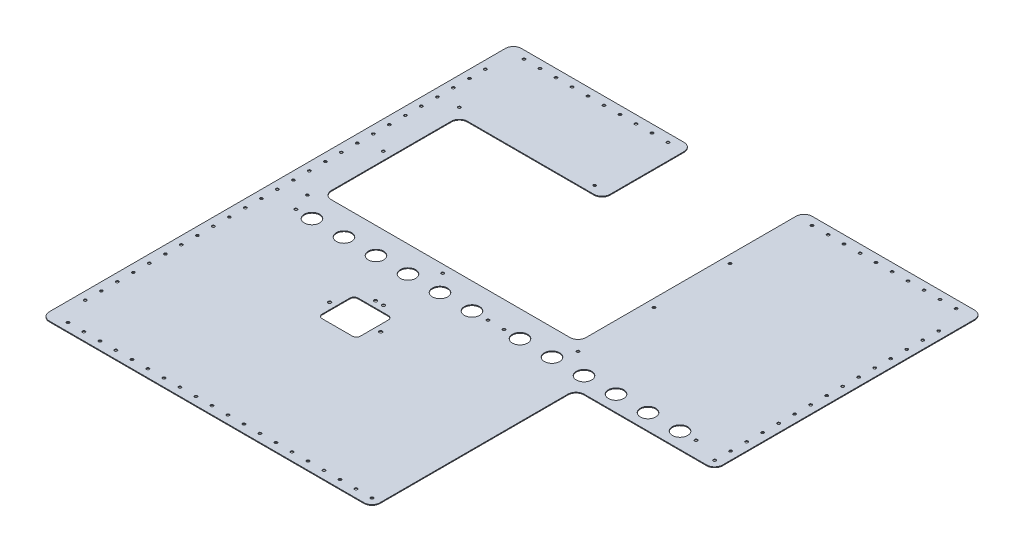
from build123d import *

# Parameters (mm, degrees)
SKETCH1_W                      = 586.53
SKETCH1_H                      = 590
BASE_FLANGE1_DEPTH             = 1
SKETCH6_W                      = 173.27
SKETCH6_H                      = 255
SKETCH6_W_2                    = 318.27
SKETCH6_H_2                    = 170
CUT_EXTRUDE1_DEPTH             = 10
SKETCH9_W                      = 140
SKETCH9_H                      = 112.51
CUT_EXTRUDE2_DEPTH             = 10
FILLET1_R                      = 10
M3_CLEARANCE_HOLE1_AT_2_COUNT  = 2
M3_CLEARANCE_HOLE1_AT_2_PITCH  = 169.135
M3_CLEARANCE_HOLE1_AT_3_COUNT  = 2
M3_CLEARANCE_HOLE1_AT_3_PITCH  = 338.27
M3_CLEARANCE_HOLE1_AT_4_COUNT  = 2
M3_CLEARANCE_HOLE1_AT_4_PITCH  = 351.356788607
M3_CLEARANCE_HOLE1_AT_5_COUNT  = 2
M3_CLEARANCE_HOLE1_AT_5_PITCH  = 387.977567522
M3_CLEARANCE_HOLE1_AT_6_COUNT  = 2
M3_CLEARANCE_HOLE1_AT_6_PITCH  = 254.375014939
M3_CLEARANCE_HOLE1_AT_7_COUNT  = 2
M3_CLEARANCE_HOLE1_AT_7_PITCH  = 190
M3_CLEARANCE_HOLE1_AT_8_COUNT  = 2
M3_CLEARANCE_HOLE1_AT_8_PITCH  = 95
M3_CLEARANCE_HOLE2_AT_2_COUNT  = 2
M3_CLEARANCE_HOLE2_AT_2_PITCH  = 20
M3_CLEARANCE_HOLE2_AT_3_COUNT  = 2
M3_CLEARANCE_HOLE2_AT_3_PITCH  = 40
M3_CLEARANCE_HOLE2_AT_4_COUNT  = 2
M3_CLEARANCE_HOLE2_AT_4_PITCH  = 60
M3_CLEARANCE_HOLE2_AT_5_COUNT  = 2
M3_CLEARANCE_HOLE2_AT_5_PITCH  = 80
M3_CLEARANCE_HOLE2_AT_6_COUNT  = 2
M3_CLEARANCE_HOLE2_AT_6_PITCH  = 100
M3_CLEARANCE_HOLE2_AT_7_COUNT  = 2
M3_CLEARANCE_HOLE2_AT_7_PITCH  = 120
M3_CLEARANCE_HOLE2_AT_8_COUNT  = 2
M3_CLEARANCE_HOLE2_AT_8_PITCH  = 140
M3_CLEARANCE_HOLE2_AT_9_COUNT  = 2
M3_CLEARANCE_HOLE2_AT_9_PITCH  = 160
M3_CLEARANCE_HOLE2_AT_10_COUNT = 2
M3_CLEARANCE_HOLE2_AT_10_PITCH = 180
M3_CLEARANCE_HOLE2_AT_11_COUNT = 2
M3_CLEARANCE_HOLE2_AT_11_PITCH = 200
M3_CLEARANCE_HOLE2_AT_12_COUNT = 2
M3_CLEARANCE_HOLE2_AT_12_PITCH = 220
M3_CLEARANCE_HOLE2_AT_13_COUNT = 2
M3_CLEARANCE_HOLE2_AT_13_PITCH = 240
M3_CLEARANCE_HOLE2_AT_14_COUNT = 2
M3_CLEARANCE_HOLE2_AT_14_PITCH = 260
M3_CLEARANCE_HOLE2_AT_15_COUNT = 2
M3_CLEARANCE_HOLE2_AT_15_PITCH = 280
M3_CLEARANCE_HOLE2_AT_16_COUNT = 2
M3_CLEARANCE_HOLE2_AT_16_PITCH = 300
M3_CLEARANCE_HOLE2_AT_17_COUNT = 2
M3_CLEARANCE_HOLE2_AT_17_PITCH = 320
M3_CLEARANCE_HOLE2_AT_18_COUNT = 2
M3_CLEARANCE_HOLE2_AT_18_PITCH = 340
M3_CLEARANCE_HOLE2_AT_19_COUNT = 2
M3_CLEARANCE_HOLE2_AT_19_PITCH = 360
M3_CLEARANCE_HOLE2_AT_20_COUNT = 2
M3_CLEARANCE_HOLE2_AT_20_PITCH = 380
M3_CLEARANCE_HOLE2_AT_21_COUNT = 2
M3_CLEARANCE_HOLE2_AT_21_PITCH = 37.427631504
M3_CLEARANCE_HOLE2_AT_22_COUNT = 2
M3_CLEARANCE_HOLE2_AT_22_PITCH = 56.575857042
M3_CLEARANCE_HOLE2_AT_23_COUNT = 2
M3_CLEARANCE_HOLE2_AT_23_PITCH = 76.163164325
M3_CLEARANCE_HOLE2_AT_24_COUNT = 2
M3_CLEARANCE_HOLE2_AT_24_PITCH = 95.920944532
M3_CLEARANCE_HOLE2_AT_25_COUNT = 2
M3_CLEARANCE_HOLE2_AT_25_PITCH = 115.76194366
M3_CLEARANCE_HOLE2_AT_26_COUNT = 2
M3_CLEARANCE_HOLE2_AT_26_PITCH = 135.649650202
M3_CLEARANCE_HOLE2_AT_27_COUNT = 2
M3_CLEARANCE_HOLE2_AT_27_PITCH = 155.566151845
M3_CLEARANCE_HOLE2_AT_28_COUNT = 2
M3_CLEARANCE_HOLE2_AT_28_PITCH = 175.501645576
M3_CLEARANCE_HOLE2_AT_29_COUNT = 2
M3_CLEARANCE_HOLE2_AT_29_PITCH = 195.45032003
M3_CLEARANCE_HOLE2_AT_30_COUNT = 2
M3_CLEARANCE_HOLE2_AT_30_PITCH = 215.408513295
M3_CLEARANCE_HOLE2_AT_31_COUNT = 2
M3_CLEARANCE_HOLE2_AT_31_PITCH = 235.37380398
M3_CLEARANCE_HOLE2_AT_32_COUNT = 2
M3_CLEARANCE_HOLE2_AT_32_PITCH = 255.344527257
M3_CLEARANCE_HOLE2_AT_33_COUNT = 2
M3_CLEARANCE_HOLE2_AT_33_PITCH = 275.319500944
M3_CLEARANCE_HOLE2_AT_34_COUNT = 2
M3_CLEARANCE_HOLE2_AT_34_PITCH = 295.297862505
M3_CLEARANCE_HOLE2_AT_35_COUNT = 2
M3_CLEARANCE_HOLE2_AT_35_PITCH = 315.2789679
M3_CLEARANCE_HOLE2_AT_36_COUNT = 2
M3_CLEARANCE_HOLE2_AT_36_PITCH = 335.262326544
M3_CLEARANCE_HOLE2_AT_37_COUNT = 2
M3_CLEARANCE_HOLE2_AT_37_PITCH = 355.24755819
M3_CLEARANCE_HOLE2_AT_38_COUNT = 2
M3_CLEARANCE_HOLE2_AT_38_PITCH = 375.234363565
M3_CLEARANCE_HOLE2_AT_39_COUNT = 2
M3_CLEARANCE_HOLE2_AT_39_PITCH = 395.222503914
M3_CLEARANCE_HOLE2_AT_40_COUNT = 2
M3_CLEARANCE_HOLE2_AT_40_PITCH = 415.211786442
M3_CLEARANCE_HOLE2_AT_41_COUNT = 2
M3_CLEARANCE_HOLE2_AT_41_PITCH = 435.202053764
M3_CLEARANCE_HOLE2_AT_42_COUNT = 2
M3_CLEARANCE_HOLE2_AT_42_PITCH = 455.193176135
M3_CLEARANCE_HOLE2_AT_43_COUNT = 2
M3_CLEARANCE_HOLE2_AT_43_PITCH = 475.18504564
M3_CLEARANCE_HOLE2_AT_44_COUNT = 2
M3_CLEARANCE_HOLE2_AT_44_PITCH = 495.177571786
M3_CLEARANCE_HOLE2_AT_45_COUNT = 2
M3_CLEARANCE_HOLE2_AT_45_PITCH = 515.170678125
M3_CLEARANCE_HOLE2_AT_46_COUNT = 2
M3_CLEARANCE_HOLE2_AT_46_PITCH = 535.164299631
M3_CLEARANCE_HOLE2_AT_47_COUNT = 2
M3_CLEARANCE_HOLE2_AT_47_PITCH = 769.631530604
M3_CLEARANCE_HOLE2_AT_48_COUNT = 2
M3_CLEARANCE_HOLE2_AT_48_PITCH = 755.865525672
M3_CLEARANCE_HOLE2_AT_49_COUNT = 2
M3_CLEARANCE_HOLE2_AT_49_PITCH = 742.383117332
M3_CLEARANCE_HOLE2_AT_50_COUNT = 2
M3_CLEARANCE_HOLE2_AT_50_PITCH = 729.200036273
M3_CLEARANCE_HOLE2_AT_51_COUNT = 2
M3_CLEARANCE_HOLE2_AT_51_PITCH = 716.332808756
M3_CLEARANCE_HOLE2_AT_52_COUNT = 2
M3_CLEARANCE_HOLE2_AT_52_PITCH = 703.798758808
M3_CLEARANCE_HOLE2_AT_53_COUNT = 2
M3_CLEARANCE_HOLE2_AT_53_PITCH = 691.616001044
M3_CLEARANCE_HOLE2_AT_54_COUNT = 2
M3_CLEARANCE_HOLE2_AT_54_PITCH = 679.803422248
M3_CLEARANCE_HOLE2_AT_55_COUNT = 2
M3_CLEARANCE_HOLE2_AT_55_PITCH = 668.380649705
M3_CLEARANCE_HOLE2_AT_56_COUNT = 2
M3_CLEARANCE_HOLE2_AT_56_PITCH = 657.368004165
M3_CLEARANCE_HOLE2_AT_57_COUNT = 2
M3_CLEARANCE_HOLE2_AT_57_PITCH = 646.786435309
M3_CLEARANCE_HOLE2_AT_58_COUNT = 2
M3_CLEARANCE_HOLE2_AT_58_PITCH = 636.657437638
M3_CLEARANCE_HOLE2_AT_59_COUNT = 2
M3_CLEARANCE_HOLE2_AT_59_PITCH = 627.002944889
M3_CLEARANCE_HOLE2_AT_60_COUNT = 2
M3_CLEARANCE_HOLE2_AT_60_PITCH = 617.845201406
M3_CLEARANCE_HOLE2_AT_61_COUNT = 2
M3_CLEARANCE_HOLE2_AT_61_PITCH = 609.20660937
M3_CLEARANCE_HOLE2_AT_62_COUNT = 2
M3_CLEARANCE_HOLE2_AT_62_PITCH = 570
M3_CLEARANCE_HOLE2_AT_63_COUNT = 2
M3_CLEARANCE_HOLE2_AT_63_PITCH = 570.350769264
M3_CLEARANCE_HOLE2_AT_64_COUNT = 2
M3_CLEARANCE_HOLE2_AT_64_PITCH = 571.401785086
M3_CLEARANCE_HOLE2_AT_65_COUNT = 2
M3_CLEARANCE_HOLE2_AT_65_PITCH = 573.149195236
M3_CLEARANCE_HOLE2_AT_66_COUNT = 2
M3_CLEARANCE_HOLE2_AT_66_PITCH = 575.586657246
M3_CLEARANCE_HOLE2_AT_67_COUNT = 2
M3_CLEARANCE_HOLE2_AT_67_PITCH = 578.705451849
M3_CLEARANCE_HOLE2_AT_68_COUNT = 2
M3_CLEARANCE_HOLE2_AT_68_PITCH = 582.494635168
M3_CLEARANCE_HOLE2_AT_69_COUNT = 2
M3_CLEARANCE_HOLE2_AT_69_PITCH = 586.941223633
M3_CLEARANCE_HOLE2_AT_70_COUNT = 2
M3_CLEARANCE_HOLE2_AT_70_PITCH = 592.030404625
M3_CLEARANCE_HOLE2_AT_71_COUNT = 2
M3_CLEARANCE_HOLE2_AT_71_PITCH = 597.745765355
M3_CLEARANCE_HOLE2_AT_72_COUNT = 2
M3_CLEARANCE_HOLE2_AT_72_PITCH = 785.182017178
M3_CLEARANCE_HOLE2_AT_73_COUNT = 2
M3_CLEARANCE_HOLE2_AT_73_PITCH = 771.563607294
M3_CLEARANCE_HOLE2_AT_74_COUNT = 2
M3_CLEARANCE_HOLE2_AT_74_PITCH = 758.228197906
M3_CLEARANCE_HOLE2_AT_75_COUNT = 2
M3_CLEARANCE_HOLE2_AT_75_PITCH = 745.190982299
M3_CLEARANCE_HOLE2_AT_76_COUNT = 2
M3_CLEARANCE_HOLE2_AT_76_PITCH = 732.467883323
M3_CLEARANCE_HOLE2_AT_77_COUNT = 2
M3_CLEARANCE_HOLE2_AT_77_PITCH = 720.075551661
M3_CLEARANCE_HOLE2_AT_78_COUNT = 2
M3_CLEARANCE_HOLE2_AT_78_PITCH = 708.031355309
M3_CLEARANCE_HOLE2_AT_79_COUNT = 2
M3_CLEARANCE_HOLE2_AT_79_PITCH = 696.353358648
M3_CLEARANCE_HOLE2_AT_80_COUNT = 2
M3_CLEARANCE_HOLE2_AT_80_PITCH = 685.060289391
M3_CLEARANCE_HOLE2_AT_81_COUNT = 2
M3_CLEARANCE_HOLE2_AT_81_PITCH = 674.17149161
SKETCH14_R                     = 9.55
CUT_EXTRUDE3_DEPTH             = 10
SKETCH15_R                     = 1.95
CUT_EXTRUDE5_DEPTH             = 416.969181821
SKETCH16_R                     = 1.75
CUT_EXTRUDE6_DEPTH             = 416.969181821


# Sheet-metal steps are written as plain solids
with BuildPart() as part:
    # Sketch1 → Base-Flange1 (new body)
    with BuildSketch(Plane(origin=(0, 0, 0), x_dir=(1, 0, 0), z_dir=(0, 1, 0))):
        Rectangle(SKETCH1_W, SKETCH1_H)
    extrude(amount=-BASE_FLANGE1_DEPTH)

    # Sketch6 → Cut-Extrude1 (cut)
    with BuildSketch(Plane(origin=(0, 0, 0), x_dir=(1, 0, 0), z_dir=(0, 1, 0))):
        with Locations((206.63, -167.5)):
            Rectangle(SKETCH6_W, SKETCH6_H)
        with Locations((-89.13, 97.5)):
            Rectangle(SKETCH6_W_2, SKETCH6_H_2)
    extrude(amount=-CUT_EXTRUDE1_DEPTH, mode=Mode.SUBTRACT)

    # Sketch9 → Cut-Extrude2 (cut)
    with BuildSketch(Plane(origin=(0, 0, 0), x_dir=(1, 0, 0), z_dir=(0, 1, 0))):
        with Locations((0, 238.745)):
            Rectangle(SKETCH9_W, SKETCH9_H)
    extrude(amount=-CUT_EXTRUDE2_DEPTH, mode=Mode.SUBTRACT)

    # Fillet1
    fillet1_edges = [part.edges().sort_by_distance(p)[0] for p in [
        (293.265, -0.5, 40),
        (119.995, -0.5, 295),
        (119.995, -0.5, 40),
        (70.005, -0.5, -12.5),
        (-248.265, -0.5, -12.5),
        (-248.265, -0.5, -182.5),
        (-70, -0.5, -182.5),
        (-70, -0.5, -295),
        (70, -0.5, -295),
        (-293.265, -0.5, 295),
        (-293.265, -0.5, -295),
        (293.265, -0.5, -295),
    ]]
    fillet(fillet1_edges, radius=FILLET1_R)

    # Sketch11 → M3 Clearance Hole1 (revolve, cut)
    with BuildSketch(Plane(origin=(80.005, 0, -192.5), x_dir=(0, 0, 1), z_dir=(1, 0, 0))):
        Polygon((0, 0), (0, 1), (1.7, 1), (1.7, 0.025), (1.725, 0), align=None)
    m3_clearance_hole1 = revolve(axis=Axis((80.005, 6.35, -192.5), (0, -1, 0)), mode=Mode.SUBTRACT)

    # M3 Clearance Hole1 at 2: M3 Clearance Hole1 ×2
    with Locations(*[(-i * M3_CLEARANCE_HOLE1_AT_2_PITCH, 0, 0) for i in range(1, M3_CLEARANCE_HOLE1_AT_2_COUNT)]):
        add(m3_clearance_hole1, mode=Mode.SUBTRACT)

    # M3 Clearance Hole1 at 3: M3 Clearance Hole1 ×2
    with Locations(*[(-i * M3_CLEARANCE_HOLE1_AT_3_PITCH, 0, 0) for i in range(1, M3_CLEARANCE_HOLE1_AT_3_COUNT)]):
        add(m3_clearance_hole1, mode=Mode.SUBTRACT)

    # M3 Clearance Hole1 at 4: M3 Clearance Hole1 ×2
    with Locations(*[Vector(-0.9627535626717866, 0, 0.27038043117574634) * (i * M3_CLEARANCE_HOLE1_AT_4_PITCH) for i in range(1, M3_CLEARANCE_HOLE1_AT_4_COUNT)]):
        add(m3_clearance_hole1, mode=Mode.SUBTRACT)

    # M3 Clearance Hole1 at 5: M3 Clearance Hole1 ×2
    with Locations(*[Vector(-0.8718803052476541, 0, 0.48971903508160425) * (i * M3_CLEARANCE_HOLE1_AT_5_PITCH) for i in range(1, M3_CLEARANCE_HOLE1_AT_5_COUNT)]):
        add(m3_clearance_hole1, mode=Mode.SUBTRACT)

    # M3 Clearance Hole1 at 6: M3 Clearance Hole1 ×2
    with Locations(*[Vector(-0.6649041378566292, 0, 0.7469287030641766) * (i * M3_CLEARANCE_HOLE1_AT_6_PITCH) for i in range(1, M3_CLEARANCE_HOLE1_AT_6_COUNT)]):
        add(m3_clearance_hole1, mode=Mode.SUBTRACT)

    # M3 Clearance Hole1 at 7: M3 Clearance Hole1 ×2
    with Locations(*[(0, 0, i * M3_CLEARANCE_HOLE1_AT_7_PITCH) for i in range(1, M3_CLEARANCE_HOLE1_AT_7_COUNT)]):
        add(m3_clearance_hole1, mode=Mode.SUBTRACT)

    # M3 Clearance Hole1 at 8: M3 Clearance Hole1 ×2
    with Locations(*[(0, 0, i * M3_CLEARANCE_HOLE1_AT_8_PITCH) for i in range(1, M3_CLEARANCE_HOLE1_AT_8_COUNT)]):
        add(m3_clearance_hole1, mode=Mode.SUBTRACT)

    # Sketch13 → M3 Clearance Hole2 (revolve, cut)
    with BuildSketch(Plane(origin=(-270.005, 0, 285), x_dir=(0, 0, 1), z_dir=(1, 0, 0))):
        Polygon((0, 0), (0, 1), (1.7, 1), (1.7, 0.025), (1.725, 0), align=None)
    m3_clearance_hole2 = revolve(axis=Axis((-270.005, 6.35, 285), (0, -1, 0)), mode=Mode.SUBTRACT)

    # M3 Clearance Hole2 at 2: M3 Clearance Hole2 ×2
    with Locations(*[(i * M3_CLEARANCE_HOLE2_AT_2_PITCH, 0, 0) for i in range(1, M3_CLEARANCE_HOLE2_AT_2_COUNT)]):
        add(m3_clearance_hole2, mode=Mode.SUBTRACT)

    # M3 Clearance Hole2 at 3: M3 Clearance Hole2 ×2
    with Locations(*[(i * M3_CLEARANCE_HOLE2_AT_3_PITCH, 0, 0) for i in range(1, M3_CLEARANCE_HOLE2_AT_3_COUNT)]):
        add(m3_clearance_hole2, mode=Mode.SUBTRACT)

    # M3 Clearance Hole2 at 4: M3 Clearance Hole2 ×2
    with Locations(*[(i * M3_CLEARANCE_HOLE2_AT_4_PITCH, 0, 0) for i in range(1, M3_CLEARANCE_HOLE2_AT_4_COUNT)]):
        add(m3_clearance_hole2, mode=Mode.SUBTRACT)

    # M3 Clearance Hole2 at 5: M3 Clearance Hole2 ×2
    with Locations(*[(i * M3_CLEARANCE_HOLE2_AT_5_PITCH, 0, 0) for i in range(1, M3_CLEARANCE_HOLE2_AT_5_COUNT)]):
        add(m3_clearance_hole2, mode=Mode.SUBTRACT)

    # M3 Clearance Hole2 at 6: M3 Clearance Hole2 ×2
    with Locations(*[(i * M3_CLEARANCE_HOLE2_AT_6_PITCH, 0, 0) for i in range(1, M3_CLEARANCE_HOLE2_AT_6_COUNT)]):
        add(m3_clearance_hole2, mode=Mode.SUBTRACT)

    # M3 Clearance Hole2 at 7: M3 Clearance Hole2 ×2
    with Locations(*[(i * M3_CLEARANCE_HOLE2_AT_7_PITCH, 0, 0) for i in range(1, M3_CLEARANCE_HOLE2_AT_7_COUNT)]):
        add(m3_clearance_hole2, mode=Mode.SUBTRACT)

    # M3 Clearance Hole2 at 8: M3 Clearance Hole2 ×2
    with Locations(*[(i * M3_CLEARANCE_HOLE2_AT_8_PITCH, 0, 0) for i in range(1, M3_CLEARANCE_HOLE2_AT_8_COUNT)]):
        add(m3_clearance_hole2, mode=Mode.SUBTRACT)

    # M3 Clearance Hole2 at 9: M3 Clearance Hole2 ×2
    with Locations(*[(i * M3_CLEARANCE_HOLE2_AT_9_PITCH, 0, 0) for i in range(1, M3_CLEARANCE_HOLE2_AT_9_COUNT)]):
        add(m3_clearance_hole2, mode=Mode.SUBTRACT)

    # M3 Clearance Hole2 at 10: M3 Clearance Hole2 ×2
    with Locations(*[(i * M3_CLEARANCE_HOLE2_AT_10_PITCH, 0, 0) for i in range(1, M3_CLEARANCE_HOLE2_AT_10_COUNT)]):
        add(m3_clearance_hole2, mode=Mode.SUBTRACT)

    # M3 Clearance Hole2 at 11: M3 Clearance Hole2 ×2
    with Locations(*[(i * M3_CLEARANCE_HOLE2_AT_11_PITCH, 0, 0) for i in range(1, M3_CLEARANCE_HOLE2_AT_11_COUNT)]):
        add(m3_clearance_hole2, mode=Mode.SUBTRACT)

    # M3 Clearance Hole2 at 12: M3 Clearance Hole2 ×2
    with Locations(*[(i * M3_CLEARANCE_HOLE2_AT_12_PITCH, 0, 0) for i in range(1, M3_CLEARANCE_HOLE2_AT_12_COUNT)]):
        add(m3_clearance_hole2, mode=Mode.SUBTRACT)

    # M3 Clearance Hole2 at 13: M3 Clearance Hole2 ×2
    with Locations(*[(i * M3_CLEARANCE_HOLE2_AT_13_PITCH, 0, 0) for i in range(1, M3_CLEARANCE_HOLE2_AT_13_COUNT)]):
        add(m3_clearance_hole2, mode=Mode.SUBTRACT)

    # M3 Clearance Hole2 at 14: M3 Clearance Hole2 ×2
    with Locations(*[(i * M3_CLEARANCE_HOLE2_AT_14_PITCH, 0, 0) for i in range(1, M3_CLEARANCE_HOLE2_AT_14_COUNT)]):
        add(m3_clearance_hole2, mode=Mode.SUBTRACT)

    # M3 Clearance Hole2 at 15: M3 Clearance Hole2 ×2
    with Locations(*[(i * M3_CLEARANCE_HOLE2_AT_15_PITCH, 0, 0) for i in range(1, M3_CLEARANCE_HOLE2_AT_15_COUNT)]):
        add(m3_clearance_hole2, mode=Mode.SUBTRACT)

    # M3 Clearance Hole2 at 16: M3 Clearance Hole2 ×2
    with Locations(*[(i * M3_CLEARANCE_HOLE2_AT_16_PITCH, 0, 0) for i in range(1, M3_CLEARANCE_HOLE2_AT_16_COUNT)]):
        add(m3_clearance_hole2, mode=Mode.SUBTRACT)

    # M3 Clearance Hole2 at 17: M3 Clearance Hole2 ×2
    with Locations(*[(i * M3_CLEARANCE_HOLE2_AT_17_PITCH, 0, 0) for i in range(1, M3_CLEARANCE_HOLE2_AT_17_COUNT)]):
        add(m3_clearance_hole2, mode=Mode.SUBTRACT)

    # M3 Clearance Hole2 at 18: M3 Clearance Hole2 ×2
    with Locations(*[(i * M3_CLEARANCE_HOLE2_AT_18_PITCH, 0, 0) for i in range(1, M3_CLEARANCE_HOLE2_AT_18_COUNT)]):
        add(m3_clearance_hole2, mode=Mode.SUBTRACT)

    # M3 Clearance Hole2 at 19: M3 Clearance Hole2 ×2
    with Locations(*[(i * M3_CLEARANCE_HOLE2_AT_19_PITCH, 0, 0) for i in range(1, M3_CLEARANCE_HOLE2_AT_19_COUNT)]):
        add(m3_clearance_hole2, mode=Mode.SUBTRACT)

    # M3 Clearance Hole2 at 20: M3 Clearance Hole2 ×2
    with Locations(*[(i * M3_CLEARANCE_HOLE2_AT_20_PITCH, 0, 0) for i in range(1, M3_CLEARANCE_HOLE2_AT_20_COUNT)]):
        add(m3_clearance_hole2, mode=Mode.SUBTRACT)

    # M3 Clearance Hole2 at 21: M3 Clearance Hole2 ×2
    with Locations(*[Vector(-0.3542837061057186, 0, -0.9351379874585337) * (i * M3_CLEARANCE_HOLE2_AT_21_PITCH) for i in range(1, M3_CLEARANCE_HOLE2_AT_21_COUNT)]):
        add(m3_clearance_hole2, mode=Mode.SUBTRACT)

    # M3 Clearance Hole2 at 22: M3 Clearance Hole2 ×2
    with Locations(*[Vector(-0.23437559222889967, 0, -0.9721461216130797) * (i * M3_CLEARANCE_HOLE2_AT_22_PITCH) for i in range(1, M3_CLEARANCE_HOLE2_AT_22_COUNT)]):
        add(m3_clearance_hole2, mode=Mode.SUBTRACT)

    # M3 Clearance Hole2 at 23: M3 Clearance Hole2 ×2
    with Locations(*[Vector(-0.1740999092870426, 0, -0.9847279937049843) * (i * M3_CLEARANCE_HOLE2_AT_23_PITCH) for i in range(1, M3_CLEARANCE_HOLE2_AT_23_COUNT)]):
        add(m3_clearance_hole2, mode=Mode.SUBTRACT)

    # M3 Clearance Hole2 at 24: M3 Clearance Hole2 ×2
    with Locations(*[Vector(-0.138238838917109, 0, -0.9903989213518205) * (i * M3_CLEARANCE_HOLE2_AT_24_PITCH) for i in range(1, M3_CLEARANCE_HOLE2_AT_24_COUNT)]):
        add(m3_clearance_hole2, mode=Mode.SUBTRACT)

    # M3 Clearance Hole2 at 25: M3 Clearance Hole2 ×2
    with Locations(*[Vector(-0.11454541605587176, 0, -0.9934180125509037) * (i * M3_CLEARANCE_HOLE2_AT_25_PITCH) for i in range(1, M3_CLEARANCE_HOLE2_AT_25_COUNT)]):
        add(m3_clearance_hole2, mode=Mode.SUBTRACT)

    # M3 Clearance Hole2 at 26: M3 Clearance Hole2 ×2
    with Locations(*[Vector(-0.09775181860201942, 0, -0.9952108228712135) * (i * M3_CLEARANCE_HOLE2_AT_26_PITCH) for i in range(1, M3_CLEARANCE_HOLE2_AT_26_COUNT)]):
        add(m3_clearance_hole2, mode=Mode.SUBTRACT)

    # M3 Clearance Hole2 at 27: M3 Clearance Hole2 ×2
    with Locations(*[Vector(-0.08523705087964259, 0, -0.9963607003276179) * (i * M3_CLEARANCE_HOLE2_AT_27_PITCH) for i in range(1, M3_CLEARANCE_HOLE2_AT_27_COUNT)]):
        add(m3_clearance_hole2, mode=Mode.SUBTRACT)

    # M3 Clearance Hole2 at 28: M3 Clearance Hole2 ×2
    with Locations(*[Vector(-0.07555484711528443, 0, -0.9971416474490402) * (i * M3_CLEARANCE_HOLE2_AT_28_PITCH) for i in range(1, M3_CLEARANCE_HOLE2_AT_28_COUNT)]):
        add(m3_clearance_hole2, mode=Mode.SUBTRACT)

    # M3 Clearance Hole2 at 29: M3 Clearance Hole2 ×2
    with Locations(*[Vector(-0.06784332713262199, 0, -0.997695987244399) * (i * M3_CLEARANCE_HOLE2_AT_29_PITCH) for i in range(1, M3_CLEARANCE_HOLE2_AT_29_COUNT)]):
        add(m3_clearance_hole2, mode=Mode.SUBTRACT)

    # M3 Clearance Hole2 at 30: M3 Clearance Hole2 ×2
    with Locations(*[Vector(-0.06155745563238609, 0, -0.9981035415507085) * (i * M3_CLEARANCE_HOLE2_AT_30_PITCH) for i in range(1, M3_CLEARANCE_HOLE2_AT_30_COUNT)]):
        add(m3_clearance_hole2, mode=Mode.SUBTRACT)

    # M3 Clearance Hole2 at 31: M3 Clearance Hole2 ×2
    with Locations(*[Vector(-0.056335920887480066, 0, -0.9984118709319113) * (i * M3_CLEARANCE_HOLE2_AT_31_PITCH) for i in range(1, M3_CLEARANCE_HOLE2_AT_31_COUNT)]):
        add(m3_clearance_hole2, mode=Mode.SUBTRACT)

    # M3 Clearance Hole2 at 32: M3 Clearance Hole2 ×2
    with Locations(*[Vector(-0.051929838256000956, 0, -0.9986507356922668) * (i * M3_CLEARANCE_HOLE2_AT_32_PITCH) for i in range(1, M3_CLEARANCE_HOLE2_AT_32_COUNT)]):
        add(m3_clearance_hole2, mode=Mode.SUBTRACT)

    # M3 Clearance Hole2 at 33: M3 Clearance Hole2 ×2
    with Locations(*[Vector(-0.04816222590314291, 0, -0.9988395266488279) * (i * M3_CLEARANCE_HOLE2_AT_33_PITCH) for i in range(1, M3_CLEARANCE_HOLE2_AT_33_COUNT)]):
        add(m3_clearance_hole2, mode=Mode.SUBTRACT)

    # M3 Clearance Hole2 at 34: M3 Clearance Hole2 ×2
    with Locations(*[Vector(-0.04490381300940858, 0, -0.9989913150659601) * (i * M3_CLEARANCE_HOLE2_AT_34_PITCH) for i in range(1, M3_CLEARANCE_HOLE2_AT_34_COUNT)]):
        add(m3_clearance_hole2, mode=Mode.SUBTRACT)

    # M3 Clearance Hole2 at 35: M3 Clearance Hole2 ×2
    with Locations(*[Vector(-0.04205799101769677, 0, -0.9991151712348059) * (i * M3_CLEARANCE_HOLE2_AT_35_PITCH) for i in range(1, M3_CLEARANCE_HOLE2_AT_35_COUNT)]):
        add(m3_clearance_hole2, mode=Mode.SUBTRACT)

    # M3 Clearance Hole2 at 36: M3 Clearance Hole2 ×2
    with Locations(*[Vector(-0.039551118482866195, 0, -0.9992175483981225) * (i * M3_CLEARANCE_HOLE2_AT_36_PITCH) for i in range(1, M3_CLEARANCE_HOLE2_AT_36_COUNT)]):
        add(m3_clearance_hole2, mode=Mode.SUBTRACT)

    # M3 Clearance Hole2 at 37: M3 Clearance Hole2 ×2
    with Locations(*[Vector(-0.03732608344321662, 0, -0.9993031389397264) * (i * M3_CLEARANCE_HOLE2_AT_37_PITCH) for i in range(1, M3_CLEARANCE_HOLE2_AT_37_COUNT)]):
        add(m3_clearance_hole2, mode=Mode.SUBTRACT)

    # M3 Clearance Hole2 at 38: M3 Clearance Hole2 ×2
    with Locations(*[Vector(-0.03533791488077733, 0, -0.9993754208363737) * (i * M3_CLEARANCE_HOLE2_AT_38_PITCH) for i in range(1, M3_CLEARANCE_HOLE2_AT_38_COUNT)]):
        add(m3_clearance_hole2, mode=Mode.SUBTRACT)

    # M3 Clearance Hole2 at 39: M3 Clearance Hole2 ×2
    with Locations(*[Vector(-0.03355072109681487, 0, -0.9994370160814956) * (i * M3_CLEARANCE_HOLE2_AT_39_PITCH) for i in range(1, M3_CLEARANCE_HOLE2_AT_39_COUNT)]):
        add(m3_clearance_hole2, mode=Mode.SUBTRACT)

    # M3 Clearance Hole2 at 40: M3 Clearance Hole2 ×2
    with Locations(*[Vector(-0.03193550961941994, 0, -0.9994899315277508) * (i * M3_CLEARANCE_HOLE2_AT_40_PITCH) for i in range(1, M3_CLEARANCE_HOLE2_AT_40_COUNT)]):
        add(m3_clearance_hole2, mode=Mode.SUBTRACT)

    # M3 Clearance Hole2 at 41: M3 Clearance Hole2 ×2
    with Locations(*[Vector(-0.03046860621481826, 0, -0.9995357242416733) * (i * M3_CLEARANCE_HOLE2_AT_41_PITCH) for i in range(1, M3_CLEARANCE_HOLE2_AT_41_COUNT)]):
        add(m3_clearance_hole2, mode=Mode.SUBTRACT)

    # M3 Clearance Hole2 at 42: M3 Clearance Hole2 ×2
    with Locations(*[Vector(-0.02913048941679347, 0, -0.9995756172428067) * (i * M3_CLEARANCE_HOLE2_AT_42_PITCH) for i in range(1, M3_CLEARANCE_HOLE2_AT_42_COUNT)]):
        add(m3_clearance_hole2, mode=Mode.SUBTRACT)

    # M3 Clearance Hole2 at 43: M3 Clearance Hole2 ×2
    with Locations(*[Vector(-0.027904918561018805, 0, -0.9996105819368375) * (i * M3_CLEARANCE_HOLE2_AT_43_PITCH) for i in range(1, M3_CLEARANCE_HOLE2_AT_43_COUNT)]):
        add(m3_clearance_hole2, mode=Mode.SUBTRACT)

    # M3 Clearance Hole2 at 44: M3 Clearance Hole2 ×2
    with Locations(*[Vector(-0.026778272594560903, 0, -0.9996413977606426) * (i * M3_CLEARANCE_HOLE2_AT_44_PITCH) for i in range(1, M3_CLEARANCE_HOLE2_AT_44_COUNT)]):
        add(m3_clearance_hole2, mode=Mode.SUBTRACT)

    # M3 Clearance Hole2 at 45: M3 Clearance Hole2 ×2
    with Locations(*[Vector(-0.02573904254072972, 0, -0.9996686959633609) * (i * M3_CLEARANCE_HOLE2_AT_45_PITCH) for i in range(1, M3_CLEARANCE_HOLE2_AT_45_COUNT)]):
        add(m3_clearance_hole2, mode=Mode.SUBTRACT)

    # M3 Clearance Hole2 at 46: M3 Clearance Hole2 ×2
    with Locations(*[Vector(-0.024777437525511124, 0, -0.9996929921679303) * (i * M3_CLEARANCE_HOLE2_AT_46_PITCH) for i in range(1, M3_CLEARANCE_HOLE2_AT_46_COUNT)]):
        add(m3_clearance_hole2, mode=Mode.SUBTRACT)

    # M3 Clearance Hole2 at 47: M3 Clearance Hole2 ×2
    with Locations(*[Vector(0.7188764727008147, 0, -0.6951378402858205) * (i * M3_CLEARANCE_HOLE2_AT_47_PITCH) for i in range(1, M3_CLEARANCE_HOLE2_AT_47_COUNT)]):
        add(m3_clearance_hole2, mode=Mode.SUBTRACT)

    # M3 Clearance Hole2 at 48: M3 Clearance Hole2 ×2
    with Locations(*[Vector(0.7319688240945119, 0, -0.6813381249817874) * (i * M3_CLEARANCE_HOLE2_AT_48_PITCH) for i in range(1, M3_CLEARANCE_HOLE2_AT_48_COUNT)]):
        add(m3_clearance_hole2, mode=Mode.SUBTRACT)

    # M3 Clearance Hole2 at 49: M3 Clearance Hole2 ×2
    with Locations(*[Vector(0.7452620986158033, 0, -0.6667716283456944) * (i * M3_CLEARANCE_HOLE2_AT_49_PITCH) for i in range(1, M3_CLEARANCE_HOLE2_AT_49_COUNT)]):
        add(m3_clearance_hole2, mode=Mode.SUBTRACT)

    # M3 Clearance Hole2 at 50: M3 Clearance Hole2 ×2
    with Locations(*[Vector(0.7587355629164406, 0, -0.6513987607954685) * (i * M3_CLEARANCE_HOLE2_AT_50_PITCH) for i in range(1, M3_CLEARANCE_HOLE2_AT_50_COUNT)]):
        add(m3_clearance_hole2, mode=Mode.SUBTRACT)

    # M3 Clearance Hole2 at 51: M3 Clearance Hole2 ×2
    with Locations(*[Vector(0.7723644557911035, 0, -0.6351796182423618) * (i * M3_CLEARANCE_HOLE2_AT_51_PITCH) for i in range(1, M3_CLEARANCE_HOLE2_AT_51_COUNT)]):
        add(m3_clearance_hole2, mode=Mode.SUBTRACT)

    # M3 Clearance Hole2 at 52: M3 Clearance Hole2 ×2
    with Locations(*[Vector(0.7861196017692288, 0, -0.6180744062927934) * (i * M3_CLEARANCE_HOLE2_AT_52_PITCH) for i in range(1, M3_CLEARANCE_HOLE2_AT_52_COUNT)]):
        add(m3_clearance_hole2, mode=Mode.SUBTRACT)

    # M3 Clearance Hole2 at 53: M3 Clearance Hole2 ×2
    with Locations(*[Vector(0.7999670325222225, 0, -0.600043954121354) * (i * M3_CLEARANCE_HOLE2_AT_53_PITCH) for i in range(1, M3_CLEARANCE_HOLE2_AT_53_COUNT)]):
        add(m3_clearance_hole2, mode=Mode.SUBTRACT)

    # M3 Clearance Hole2 at 54: M3 Clearance Hole2 ×2
    with Locations(*[Vector(0.8138676298075721, 0, -0.5810503258336619) * (i * M3_CLEARANCE_HOLE2_AT_54_PITCH) for i in range(1, M3_CLEARANCE_HOLE2_AT_54_COUNT)]):
        add(m3_clearance_hole2, mode=Mode.SUBTRACT)

    # M3 Clearance Hole2 at 55: M3 Clearance Hole2 ×2
    with Locations(*[Vector(0.8277768068902698, 0, -0.5610575353513659) * (i * M3_CLEARANCE_HOLE2_AT_55_PITCH) for i in range(1, M3_CLEARANCE_HOLE2_AT_55_COUNT)]):
        add(m3_clearance_hole2, mode=Mode.SUBTRACT)

    # M3 Clearance Hole2 at 56: M3 Clearance Hole2 ×2
    with Locations(*[Vector(0.8416442487228958, 0, -0.5400323680962766) * (i * M3_CLEARANCE_HOLE2_AT_56_PITCH) for i in range(1, M3_CLEARANCE_HOLE2_AT_56_COUNT)]):
        add(m3_clearance_hole2, mode=Mode.SUBTRACT)

    # M3 Clearance Hole2 at 57: M3 Clearance Hole2 ×2
    with Locations(*[Vector(0.8554137344199167, 0, -0.5179453088558408) * (i * M3_CLEARANCE_HOLE2_AT_57_PITCH) for i in range(1, M3_CLEARANCE_HOLE2_AT_57_COUNT)]):
        add(m3_clearance_hole2, mode=Mode.SUBTRACT)

    # M3 Clearance Hole2 at 58: M3 Clearance Hole2 ×2
    with Locations(*[Vector(0.8690230684376916, 0, -0.4947715700433274) * (i * M3_CLEARANCE_HOLE2_AT_58_PITCH) for i in range(1, M3_CLEARANCE_HOLE2_AT_58_COUNT)]):
        add(m3_clearance_hole2, mode=Mode.SUBTRACT)

    # M3 Clearance Hole2 at 59: M3 Clearance Hole2 ×2
    with Locations(*[Vector(0.8824041489910074, 0, -0.4704922080581741) * (i * M3_CLEARANCE_HOLE2_AT_59_PITCH) for i in range(1, M3_CLEARANCE_HOLE2_AT_59_COUNT)]):
        add(m3_clearance_hole2, mode=Mode.SUBTRACT)

    # M3 Clearance Hole2 at 60: M3 Clearance Hole2 ×2
    with Locations(*[Vector(0.8954832031409422, 0, -0.44509530765043814) * (i * M3_CLEARANCE_HOLE2_AT_60_PITCH) for i in range(1, M3_CLEARANCE_HOLE2_AT_60_COUNT)]):
        add(m3_clearance_hole2, mode=Mode.SUBTRACT)

    # M3 Clearance Hole2 at 61: M3 Clearance Hole2 ×2
    with Locations(*[Vector(0.9081812171608301, 0, -0.41857720529942055) * (i * M3_CLEARANCE_HOLE2_AT_61_PITCH) for i in range(1, M3_CLEARANCE_HOLE2_AT_61_COUNT)]):
        add(m3_clearance_hole2, mode=Mode.SUBTRACT)

    # M3 Clearance Hole2 at 62: M3 Clearance Hole2 ×2
    with Locations(*[(0, 0, -i * M3_CLEARANCE_HOLE2_AT_62_PITCH) for i in range(1, M3_CLEARANCE_HOLE2_AT_62_COUNT)]):
        add(m3_clearance_hole2, mode=Mode.SUBTRACT)

    # M3 Clearance Hole2 at 63: M3 Clearance Hole2 ×2
    with Locations(*[Vector(0.0350661401330445, 0, -0.9993849937917668) * (i * M3_CLEARANCE_HOLE2_AT_63_PITCH) for i in range(1, M3_CLEARANCE_HOLE2_AT_63_COUNT)]):
        add(m3_clearance_hole2, mode=Mode.SUBTRACT)

    # M3 Clearance Hole2 at 64: M3 Clearance Hole2 ×2
    with Locations(*[Vector(0.07000328148073091, 0, -0.9975467611004155) * (i * M3_CLEARANCE_HOLE2_AT_64_PITCH) for i in range(1, M3_CLEARANCE_HOLE2_AT_64_COUNT)]):
        add(m3_clearance_hole2, mode=Mode.SUBTRACT)

    # M3 Clearance Hole2 at 65: M3 Clearance Hole2 ×2
    with Locations(*[Vector(0.10468478451804275, 0, -0.9945054529214061) * (i * M3_CLEARANCE_HOLE2_AT_65_PITCH) for i in range(1, M3_CLEARANCE_HOLE2_AT_65_COUNT)]):
        add(m3_clearance_hole2, mode=Mode.SUBTRACT)

    # M3 Clearance Hole2 at 66: M3 Clearance Hole2 ×2
    with Locations(*[Vector(0.13898862837218873, 0, -0.9902939771518444) * (i * M3_CLEARANCE_HOLE2_AT_66_PITCH) for i in range(1, M3_CLEARANCE_HOLE2_AT_66_COUNT)]):
        add(m3_clearance_hole2, mode=Mode.SUBTRACT)

    # M3 Clearance Hole2 at 67: M3 Clearance Hole2 ×2
    with Locations(*[Vector(0.17279947800812526, 0, -0.984957024646314) * (i * M3_CLEARANCE_HOLE2_AT_67_PITCH) for i in range(1, M3_CLEARANCE_HOLE2_AT_67_COUNT)]):
        add(m3_clearance_hole2, mode=Mode.SUBTRACT)

    # M3 Clearance Hole2 at 68: M3 Clearance Hole2 ×2
    with Locations(*[Vector(0.2060104810498419, 0, -0.978549784986749) * (i * M3_CLEARANCE_HOLE2_AT_68_PITCH) for i in range(1, M3_CLEARANCE_HOLE2_AT_68_COUNT)]):
        add(m3_clearance_hole2, mode=Mode.SUBTRACT)

    # M3 Clearance Hole2 at 69: M3 Clearance Hole2 ×2
    with Locations(*[Vector(0.23852473529359494, 0, -0.9711364222667794) * (i * M3_CLEARANCE_HOLE2_AT_69_PITCH) for i in range(1, M3_CLEARANCE_HOLE2_AT_69_COUNT)]):
        add(m3_clearance_hole2, mode=Mode.SUBTRACT)

    # M3 Clearance Hole2 at 70: M3 Clearance Hole2 ×2
    with Locations(*[Vector(0.27025639012821795, 0, -0.9627883898317764) * (i * M3_CLEARANCE_HOLE2_AT_70_PITCH) for i in range(1, M3_CLEARANCE_HOLE2_AT_70_COUNT)]):
        add(m3_clearance_hole2, mode=Mode.SUBTRACT)

    # M3 Clearance Hole2 at 71: M3 Clearance Hole2 ×2
    with Locations(*[Vector(0.3011313679370974, 0, -0.9535826651341417) * (i * M3_CLEARANCE_HOLE2_AT_71_PITCH) for i in range(1, M3_CLEARANCE_HOLE2_AT_71_COUNT)]):
        add(m3_clearance_hole2, mode=Mode.SUBTRACT)

    # M3 Clearance Hole2 at 72: M3 Clearance Hole2 ×2
    with Locations(*[Vector(0.687751359793884, 0, -0.725946325220855) * (i * M3_CLEARANCE_HOLE2_AT_72_PITCH) for i in range(1, M3_CLEARANCE_HOLE2_AT_72_COUNT)]):
        add(m3_clearance_hole2, mode=Mode.SUBTRACT)

    # M3 Clearance Hole2 at 73: M3 Clearance Hole2 ×2
    with Locations(*[Vector(0.6739690611173222, 0, -0.7387595716176103) * (i * M3_CLEARANCE_HOLE2_AT_73_PITCH) for i in range(1, M3_CLEARANCE_HOLE2_AT_73_COUNT)]):
        add(m3_clearance_hole2, mode=Mode.SUBTRACT)

    # M3 Clearance Hole2 at 74: M3 Clearance Hole2 ×2
    with Locations(*[Vector(0.659445271727935, 0, -0.7517525747183511) * (i * M3_CLEARANCE_HOLE2_AT_74_PITCH) for i in range(1, M3_CLEARANCE_HOLE2_AT_74_COUNT)]):
        add(m3_clearance_hole2, mode=Mode.SUBTRACT)

    # M3 Clearance Hole2 at 75: M3 Clearance Hole2 ×2
    with Locations(*[Vector(0.6441435972816062, 0, -0.7649045862596929) * (i * M3_CLEARANCE_HOLE2_AT_75_PITCH) for i in range(1, M3_CLEARANCE_HOLE2_AT_75_COUNT)]):
        add(m3_clearance_hole2, mode=Mode.SUBTRACT)

    # M3 Clearance Hole2 at 76: M3 Clearance Hole2 ×2
    with Locations(*[Vector(0.628027536051036, 0, -0.7781911166041828) * (i * M3_CLEARANCE_HOLE2_AT_76_PITCH) for i in range(1, M3_CLEARANCE_HOLE2_AT_76_COUNT)]):
        add(m3_clearance_hole2, mode=Mode.SUBTRACT)

    # M3 Clearance Hole2 at 77: M3 Clearance Hole2 ×2
    with Locations(*[Vector(0.6110608796326762, 0, -0.7915836035331582) * (i * M3_CLEARANCE_HOLE2_AT_77_PITCH) for i in range(1, M3_CLEARANCE_HOLE2_AT_77_COUNT)]):
        add(m3_clearance_hole2, mode=Mode.SUBTRACT)

    # M3 Clearance Hole2 at 78: M3 Clearance Hole2 ×2
    with Locations(*[Vector(0.593208191771383, 0, -0.8050490924256273) * (i * M3_CLEARANCE_HOLE2_AT_78_PITCH) for i in range(1, M3_CLEARANCE_HOLE2_AT_78_COUNT)]):
        add(m3_clearance_hole2, mode=Mode.SUBTRACT)

    # M3 Clearance Hole2 at 79: M3 Clearance Hole2 ×2
    with Locations(*[Vector(0.574435371112134, 0, -0.8185499400862875) * (i * M3_CLEARANCE_HOLE2_AT_79_PITCH) for i in range(1, M3_CLEARANCE_HOLE2_AT_79_COUNT)]):
        add(m3_clearance_hole2, mode=Mode.SUBTRACT)

    # M3 Clearance Hole2 at 80: M3 Clearance Hole2 ×2
    with Locations(*[Vector(0.5547103019765074, 0, -0.8320435570816783) * (i * M3_CLEARANCE_HOLE2_AT_80_PITCH) for i in range(1, M3_CLEARANCE_HOLE2_AT_80_COUNT)]):
        add(m3_clearance_hole2, mode=Mode.SUBTRACT)

    # M3 Clearance Hole2 at 81: M3 Clearance Hole2 ×2
    with Locations(*[Vector(0.5340035947531943, 0, -0.8454822060757199) * (i * M3_CLEARANCE_HOLE2_AT_81_PITCH) for i in range(1, M3_CLEARANCE_HOLE2_AT_81_COUNT)]):
        add(m3_clearance_hole2, mode=Mode.SUBTRACT)

    # Sketch14 → Cut-Extrude3 (cut)
    with BuildSketch(Plane(origin=(0, 0, 0), x_dir=(1, 0, 0), z_dir=(0, 1, 0))):
        with Locations(Location((-230, -20, 0), (0, 0, 270))):
            Circle(SKETCH14_R)
        with Locations(Location((-190, -20, 0), (0, 0, 270))):
            Circle(SKETCH14_R)
        with Locations(Location((-150, -20, 0), (0, 0, 270))):
            Circle(SKETCH14_R)
        with Locations(Location((-110, -20, 0), (0, 0, 270))):
            Circle(SKETCH14_R)
        with Locations(Location((-70, -20, 0), (0, 0, 270))):
            Circle(SKETCH14_R)
        with Locations(Location((-30, -20, 0), (0, 0, 270))):
            Circle(SKETCH14_R)
        with Locations(Location((230, -20, 0), (0, 0, 270))):
            Circle(SKETCH14_R)
        with Locations(Location((190, -20, 0), (0, 0, 270))):
            Circle(SKETCH14_R)
        with Locations(Location((150, -20, 0), (0, 0, 270))):
            Circle(SKETCH14_R)
        with Locations(Location((110, -20, 0), (0, 0, 270))):
            Circle(SKETCH14_R)
        with Locations(Location((70, -20, 0), (0, 0, 270))):
            Circle(SKETCH14_R)
        with Locations(Location((30, -20, 0), (0, 0, 270))):
            Circle(SKETCH14_R)
    extrude(amount=-CUT_EXTRUDE3_DEPTH, mode=Mode.SUBTRACT)

    # Sketch15 → Cut-Extrude5 (cut, through all)
    with BuildSketch(Plane(origin=(0, 0, 0), x_dir=(1, 0, 0), z_dir=(0, 1, 0))):
        with Locations(Location((-91.365, -69.2, 0), (0, 0, 270))):
            Circle(SKETCH15_R)
        with Locations(Location((-101.365, -69.2, 0), (0, 0, 270))):
            Circle(SKETCH15_R)
        with Locations(Location((-64.465, -99.6, 0), (0, 0, 270))):
            Circle(SKETCH15_R)
        with Locations(Location((-128.265, -99.6, 0), (0, 0, 270))):
            Circle(SKETCH15_R)
        with BuildLine():
            Line((-120.265, -82.2), (-120.265, -117))
            ThreePointArc((-120.265, -117), (-118.800533906, -120.535533906), (-115.265, -122))
            Line((-115.265, -122), (-77.465, -122))
            ThreePointArc((-77.465, -122), (-73.929466094, -120.535533906), (-72.465, -117))
            Line((-72.465, -117), (-72.465, -82.2))
            ThreePointArc((-72.465, -82.2), (-73.929466094, -78.664466094), (-77.465, -77.2))
            Line((-77.465, -77.2), (-115.265, -77.2))
            ThreePointArc((-115.265, -77.2), (-118.800533906, -78.664466094), (-120.265, -82.2))
        make_face()
    extrude(amount=-CUT_EXTRUDE5_DEPTH, mode=Mode.SUBTRACT)

    # Sketch16 → Cut-Extrude6 (cut, through all)
    with BuildSketch(Plane(origin=(0, 0, 0), x_dir=(1, 0, 0), z_dir=(0, 1, 0))):
        with Locations(Location((-250, -20, 0), (0, 0, 270))):
            Circle(SKETCH16_R)
        with Locations(Location((250, -20, 0), (0, 0, 270))):
            Circle(SKETCH16_R)
        with Locations(Location((-10, -20, 0), (0, 0, 270))):
            Circle(SKETCH16_R)
        with Locations(Location((10, -20, 0), (0, 0, 270))):
            Circle(SKETCH16_R)
    extrude(amount=-CUT_EXTRUDE6_DEPTH, mode=Mode.SUBTRACT)


solid = part.part
